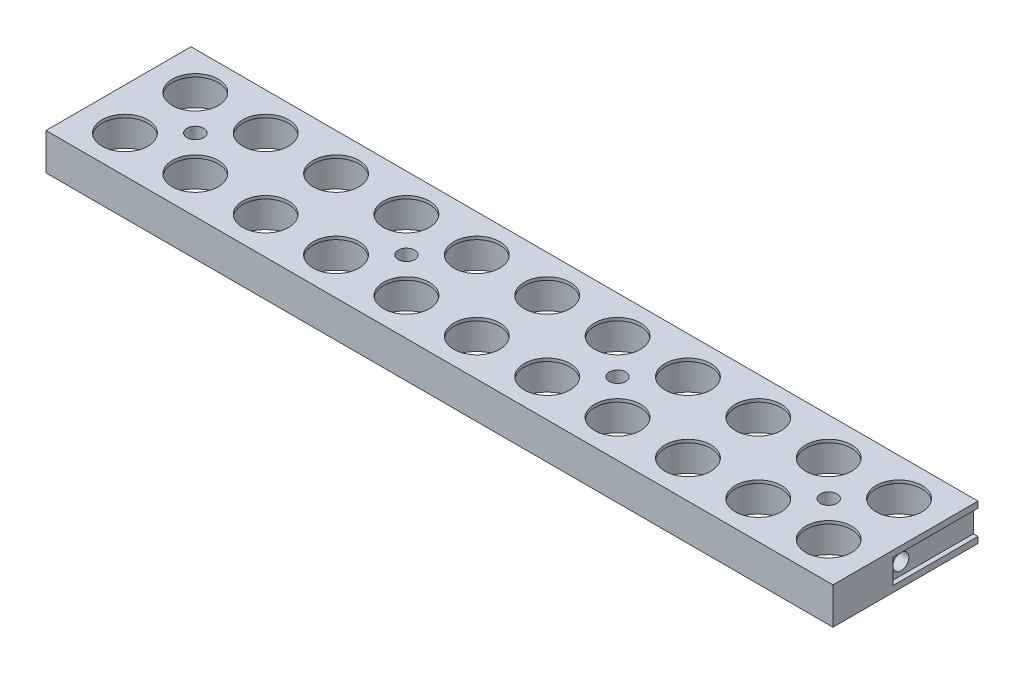
from build123d import *

# Parameters (mm, degrees)
SKETCH1_W               = 257.2
SKETCH1_H               = 47.4
BOSS_EXTRUDE1_DEPTH     = 12
CUT_EXTRUDE1_START      = -12
SKETCH2_R               = 10.8
CUT_EXTRUDE1_DEPTH      = 11
SKETCH17_R              = 7.5
CUT_EXTRUDE5_DEPTH      = 262.806417034
LPATTERN1_COUNT         = 2
LPATTERN1_PITCH         = 23
LPATTERN1_COUNT_DIR2    = 11
LPATTERN1_PITCH_DIR2    = 23
ADVANCEDHOLE1_OUTLINE_R = 2.7
ADVANCEDHOLE1_DEPTH     = 12
SKETCH9_W               = 27.7
SKETCH9_H               = 8
CUT_EXTRUDE4_DEPTH      = 1.5


# Read off the part's stored shape, not the designer's step: AdvancedHole1, AdvancedHole3
with BuildPart() as part:
    # Sketch1 → Boss-Extrude1 (new body)
    with BuildSketch(Plane(origin=(0, 0, 0), x_dir=(1, 0, 0), z_dir=(0, 1, 0))):
        with Locations((128.6, 23.7)):
            Rectangle(SKETCH1_W, SKETCH1_H)
    extrude(amount=BOSS_EXTRUDE1_DEPTH)

    # Sketch2 → Cut-Extrude1 (cut)
    with BuildSketch(Plane(origin=(0, 12, 0), x_dir=(1, 0, 0), z_dir=(0, 1, 0)).offset(CUT_EXTRUDE1_START)):
        with Locations(Location((13.6, 12.2, 0), (0, 0, 90))):
            Circle(SKETCH2_R)
    cut_extrude1 = extrude(amount=CUT_EXTRUDE1_DEPTH, mode=Mode.SUBTRACT)

    # Sketch17 → Cut-Extrude5 (cut, through all)
    with BuildSketch(Plane(origin=(0, 12, 0), x_dir=(1, 0, 0), z_dir=(0, 1, 0))):
        with Locations(Location((13.6, 12.2, 0), (0, 0, 270))):
            Circle(SKETCH17_R)
    cut_extrude5 = extrude(amount=-CUT_EXTRUDE5_DEPTH, mode=Mode.SUBTRACT)

    # LPattern1: Cut-Extrude1, Cut-Extrude5 2 × 11
    with Locations(*[(j * LPATTERN1_PITCH_DIR2, 0, -i * LPATTERN1_PITCH) for i in range(LPATTERN1_COUNT) for j in range(LPATTERN1_COUNT_DIR2) if (i, j) != (0, 0)]):
        add(cut_extrude1, mode=Mode.SUBTRACT)
        add(cut_extrude5, mode=Mode.SUBTRACT)

    # AdvancedHole1 outline → AdvancedHole1 (cut)
    with BuildSketch(Plane(origin=(0, 0, 0), x_dir=(1, 0, 0), z_dir=(0, 1, 0))):
        with Locations((163.1, 23.7)):
            Circle(ADVANCEDHOLE1_OUTLINE_R)
        with Locations((94.1, 23.7)):
            Circle(ADVANCEDHOLE1_OUTLINE_R)
        with Locations((25.1, 23.7)):
            Circle(ADVANCEDHOLE1_OUTLINE_R)
        with Locations((232.1, 23.7)):
            Circle(ADVANCEDHOLE1_OUTLINE_R)
    extrude(amount=ADVANCEDHOLE1_DEPTH, mode=Mode.SUBTRACT)

    # Sketch9 → Cut-Extrude4 (cut)
    with BuildSketch(Plane.ZY):
        with Locations((-33.55, 6)):
            Rectangle(SKETCH9_W, SKETCH9_H)
    cut_extrude4 = extrude(amount=-CUT_EXTRUDE4_DEPTH, mode=Mode.SUBTRACT)

    # AdvancedHole3 outline → AdvancedHole3 (revolve, cut)
    with BuildSketch(Plane(origin=(0, 6, -23.7), x_dir=(0, 1, 0), z_dir=(0, 0, -1))):
        Polygon((2.615, 1.5), (2.524951623, 5.39), (0, 5.39), (0, 1.5), align=None)
    advancedhole3 = revolve(axis=Axis((0, 6, -23.7), (1, 0, 0)), mode=Mode.SUBTRACT)

    # Mirror1: Cut-Extrude4, AdvancedHole3 across plane
    add(cut_extrude4.mirror(Plane(origin=(128.6, 0, 0), x_dir=(0, 0, 1), z_dir=(1, 0, 0))), mode=Mode.SUBTRACT)
    add(advancedhole3.mirror(Plane(origin=(128.6, 0, 0), x_dir=(0, 0, 1), z_dir=(1, 0, 0))), mode=Mode.SUBTRACT)


solid = part.part
